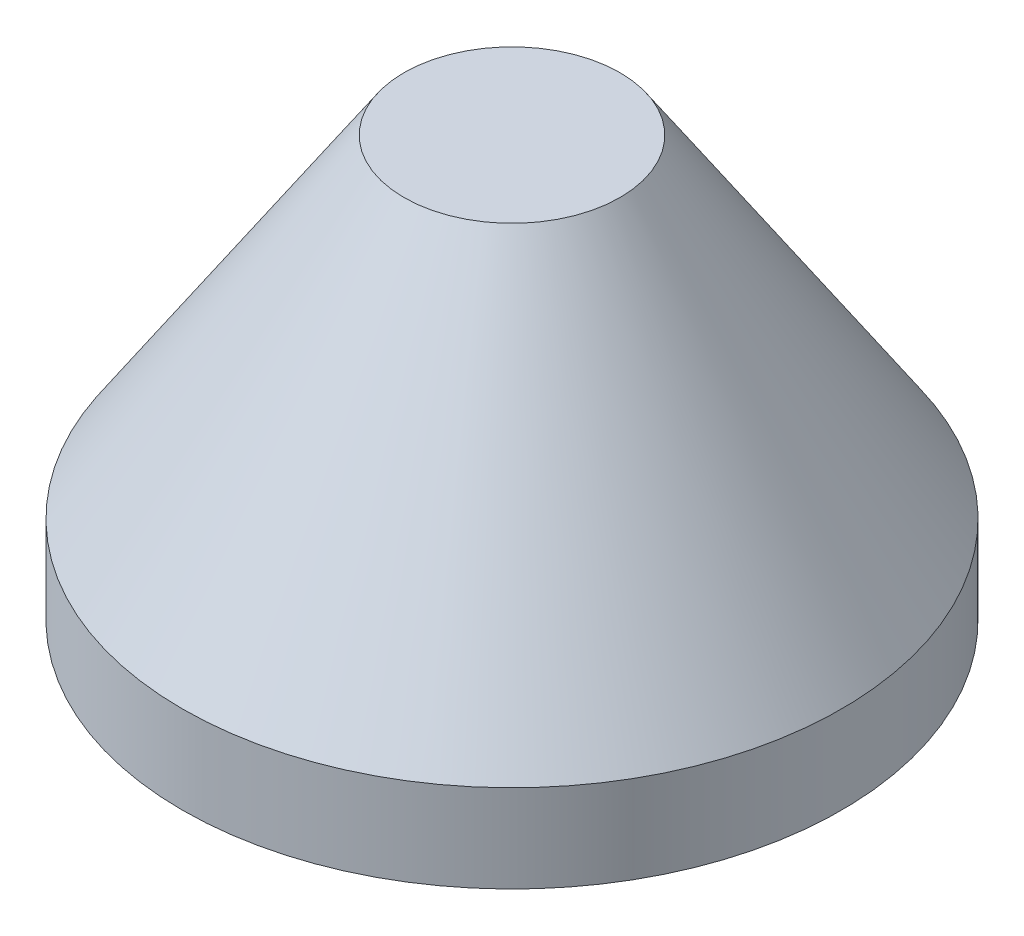
from build123d import *


with BuildPart() as part:
    # Sketch2 → Revolve1 (revolve)
    with BuildSketch(Plane(origin=(0, 0, 0), x_dir=(0, 0, -1), z_dir=(1, 0, 0))):
        Polygon((95.4405, 0), (95.4405, 25.4), (31.30423, 121.60504), (0, 121.60504), (0, 118.43004), (28.967586754, 118.43004), (92.2655, 23.482543431), (92.2655, 0), align=None)
    revolve(axis=Axis((0, 171.857284176, 0), (0, -1, 0)))


solid = part.part
